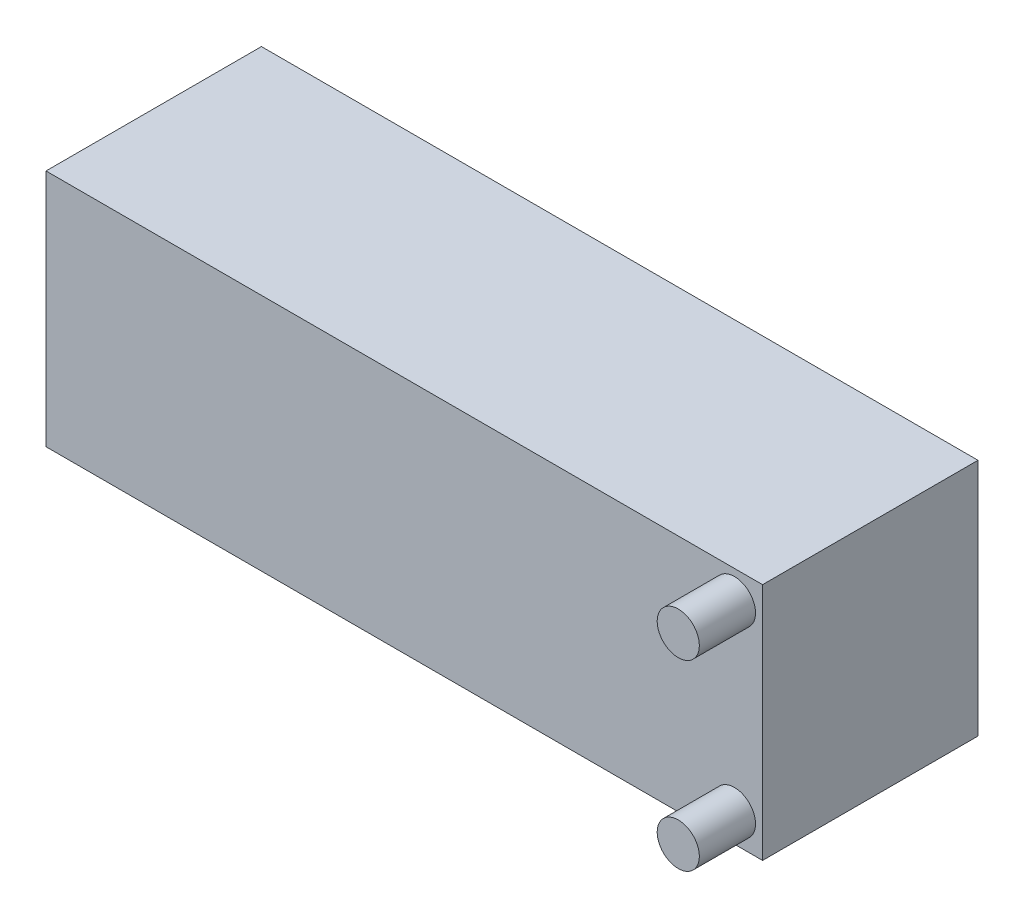
from build123d import *

# Parameters (mm, degrees)
SKETCH1_W           = 153
SKETCH1_H           = 46
BOSS_EXTRUDE1_DEPTH = 51
SKETCH2_R           = 4.5
BOSS_EXTRUDE2_DEPTH = 12


with BuildPart() as part:
    # Sketch1 → Boss-Extrude1 (new body)
    with BuildSketch(Plane(origin=(0, 0, 0), x_dir=(1, 0, 0), z_dir=(0, 1, 0))):
        with Locations((76.5, 23)):
            Rectangle(SKETCH1_W, SKETCH1_H)
    extrude(amount=BOSS_EXTRUDE1_DEPTH)

    # Sketch2 → Boss-Extrude2 (add)
    with BuildSketch(Plane.XY):
        with Locations((147, 45)):
            Circle(SKETCH2_R)
        with Locations((147, 6)):
            Circle(SKETCH2_R)
    extrude(amount=BOSS_EXTRUDE2_DEPTH)


solid = part.part
